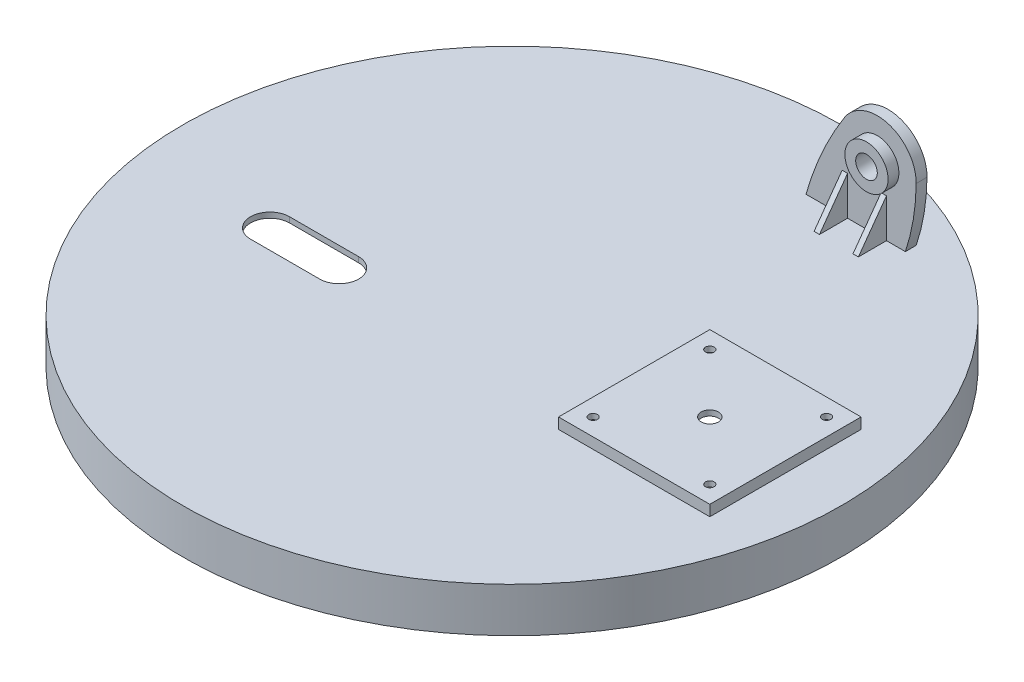
from build123d import *

# Parameters (mm, degrees)
SKETCH_1_R          = 305
EXTRUDE_1_DEPTH     = 41.2
SKETCH_2_W          = 140
SKETCH_2_H          = 140
EXTRUDE_2_DEPTH     = 10
SHELL_1_T           = -5
CUT_EXTRUDE_1_DEPTH = 10
SKETCH_4_W          = 120
SKETCH_4_H          = 10
EXTRUDE_3_DEPTH     = 150
CUT_EXTRUDE_3_DEPTH = 648.322516216
SKETCH_6_R          = 10
CUT_EXTRUDE_4_DEPTH = 150
EXTRUDE_START       = 10
SKETCH_7_R          = 20
SKETCH_7_R_2        = 10
EXTRUDE_4_DEPTH     = 10
SKETCH_8_W          = 5
SKETCH_8_H          = 36
EXTRUDE_5_DEPTH     = 26
CUT_EXTRUDE_5_DEPTH = 536.715493522
SKETCH_10_W         = 19
SKETCH_10_H         = 5
SKETCH_10_W_2       = 5
SKETCH_10_H_2       = 46.5
SKETCH_11_R         = 8
SKETCH_11_R_2       = 4
CUT_EXTRUDE_6_DEPTH = 26


with BuildPart() as part:
    # 草图1 → 凸台-拉伸1 (new body)
    with BuildSketch(Plane(origin=(0, 0, 0), x_dir=(1, 0, 0), z_dir=(0, 1, 0))):
        Circle(SKETCH_1_R)
    extrude(amount=EXTRUDE_1_DEPTH)

    # 草图2 → 凸台-拉伸2 (add)
    with BuildSketch(Plane(origin=(0, 41.2, 0), x_dir=(1, 0, 0), z_dir=(0, 1, 0))):
        with Locations((183, 0)):
            Rectangle(SKETCH_2_W, SKETCH_2_H)
    extrude(amount=EXTRUDE_2_DEPTH)

    # 抽壳1
    shell_1_openings = [part.faces().sort_by_distance(p)[0] for p in [
        (0, 0, 0),
    ]]
    offset(amount=SHELL_1_T, openings=shell_1_openings, kind=Kind.INTERSECTION)

    # 草图3 → 切除-拉伸1 (cut)
    with BuildSketch(Plane(origin=(0, 41.2, 0), x_dir=(1, 0, 0), z_dir=(0, 1, 0))):
        with BuildLine():
            Line((-182, -24), (-118, -24))
            ThreePointArc((-118, -24), (-100, -42), (-118, -60))
            Line((-118, -60), (-182, -60))
            ThreePointArc((-182, -60), (-200, -42), (-182, -24))
        make_face()
    extrude(amount=-CUT_EXTRUDE_1_DEPTH, mode=Mode.SUBTRACT)

    # 草图4 → 凸台-拉伸3 (add)
    with BuildSketch(Plane(origin=(0, 41.2, 0), x_dir=(1, 0, 0), z_dir=(0, 1, 0))):
        with Locations((99, 238)):
            Rectangle(SKETCH_4_W, SKETCH_4_H)
    extrude(amount=EXTRUDE_3_DEPTH)

    # 草图5 → 切除-拉伸3 (cut, through all)
    with BuildSketch(Plane.XY.offset(-233)):
        with BuildLine():
            Line((131, 41.2), (159.068212158, 41.2))
            Line((159.068212158, 41.2), (159, 191.2))
            Line((159, 191.2), (39, 191.2))
            Line((39, 191.2), (39, 41.2))
            ThreePointArc((39, 41.2), (53.931588882, 82.177347592), (74.646786984, 120.556716136))
            ThreePointArc((74.646786984, 120.556716136), (115.26317996, 135.706044936), (140.99801314, 100.821780537))
            ThreePointArc((140.99801314, 100.821780537), (138.32356193, 70.621084147), (131, 41.2))
        make_face()
    extrude(amount=-CUT_EXTRUDE_3_DEPTH, mode=Mode.SUBTRACT)

    # 草图6 → 切除-拉伸4 (cut)
    with BuildSketch(Plane.XY.offset(-233)):
        with Locations((105, 101.2)):
            Circle(SKETCH_6_R)
    extrude(amount=-CUT_EXTRUDE_4_DEPTH, mode=Mode.SUBTRACT)

    # 草图7 → 凸台-拉伸4 (add)
    with BuildSketch(Plane.XY.offset(-233).offset(EXTRUDE_START)):
        with Locations((105, 101.2)):
            Circle(SKETCH_7_R)
        with Locations((105, 101.2)):
            Circle(SKETCH_7_R_2, mode=Mode.SUBTRACT)
    extrude(amount=-EXTRUDE_4_DEPTH)

    # 草图8 → 凸台-拉伸5 (add)
    with BuildSketch(Plane.XY.offset(-233)):
        with Locations((75, 59.2)):
            Rectangle(SKETCH_8_W, SKETCH_8_H)
        with Locations((111, 59.2)):
            Rectangle(SKETCH_8_W, SKETCH_8_H)
    extrude(amount=EXTRUDE_5_DEPTH)

    # 草图9 → 切除-拉伸5 (cut, through all)
    with BuildSketch(Plane(origin=(113.5, 0, 0), x_dir=(0, 0, -1), z_dir=(1, 0, 0))):
        Polygon((207, 41.2), (233, 77.2), (207, 77.2), align=None)
    extrude(amount=-CUT_EXTRUDE_5_DEPTH, mode=Mode.SUBTRACT)

    # 草图10 → 旋转1 (revolve)
    with BuildSketch(Plane.XY):
        with Locations((-65.5, 33.7)):
            Rectangle(SKETCH_10_W, SKETCH_10_H)
        with Locations((-82.5, 12.95)):
            Rectangle(SKETCH_10_W_2, SKETCH_10_H_2)
    revolve(axis=Axis((0, 0, 0), (0, 1, 0)))

    # 草图11 → 切除-拉伸6 (cut)
    with BuildSketch(Plane(origin=(0, 51.2, 0), x_dir=(1, 0, 0), z_dir=(0, 1, 0))):
        with Locations((183, 0)):
            Circle(SKETCH_11_R)
        with Locations((237, 54)):
            Circle(SKETCH_11_R_2)
        with Locations((237, -54)):
            Circle(SKETCH_11_R_2)
        with Locations((129, -54)):
            Circle(SKETCH_11_R_2)
        with Locations((129, 54)):
            Circle(SKETCH_11_R_2)
    extrude(amount=-CUT_EXTRUDE_6_DEPTH, mode=Mode.SUBTRACT)


solid = part.part
